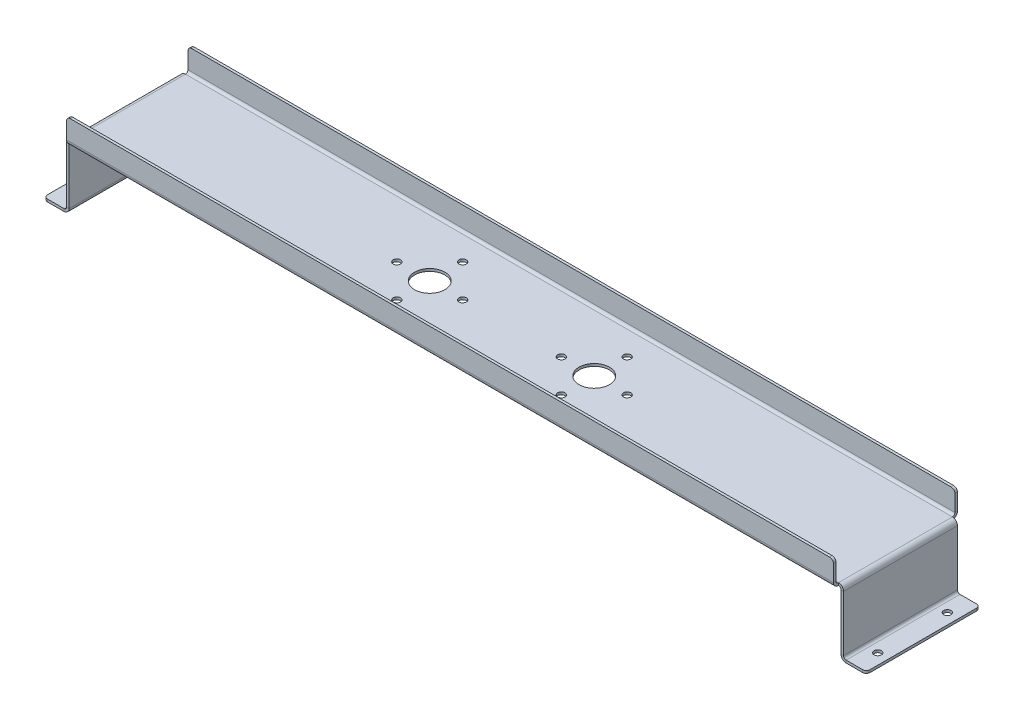
from build123d import *

# Parameters (mm, degrees)
BASE_FLANGE1_DEPTH      = 45
EDGE_FLANGE1_DEPTH      = 606
EDGE_FLANGE1_BEND_DEPTH = 606
SKETCH11_R              = 12
CUT_EXTRUDE1_DEPTH      = 10
FILLET1_R               = 3
M5_CLEARANCE_HOLE1_D    = 5.8
M5_CLEARANCE_HOLE2_D    = 5.8


# Sheet-metal steps are written as plain solids
with BuildPart() as part:
    # Sketch1 → Base-Flange1 (new, symmetric)
    with BuildSketch(Plane.XY):
        with BuildLine():
            Line((-325, 0), (-309, 0))
            ThreePointArc((-309, 0), (-306.171572875, 1.171572875), (-305, 4))
            Line((-305, 4), (-305, 48))
            ThreePointArc((-305, 48), (-304.414213562, 49.414213562), (-303, 50))
            Line((-303, 50), (303, 50))
            ThreePointArc((303, 50), (304.414213562, 49.414213562), (305, 48))
            Line((305, 48), (305, 4))
            ThreePointArc((305, 4), (306.171572875, 1.171572875), (309, 0))
            Line((309, 0), (325, 0))
            Line((325, 0), (325, 2))
            Line((325, 2), (309, 2))
            ThreePointArc((309, 2), (307.585786438, 2.585786438), (307, 4))
            Line((307, 4), (307, 48))
            ThreePointArc((307, 48), (305.828427125, 50.828427125), (303, 52))
            Line((303, 52), (-303, 52))
            ThreePointArc((-303, 52), (-305.828427125, 50.828427125), (-307, 48))
            Line((-307, 48), (-307, 4))
            ThreePointArc((-307, 4), (-307.585786438, 2.585786438), (-309, 2))
            Line((-309, 2), (-325, 2))
            Line((-325, 2), (-325, 0))
        make_face()
    extrude(amount=BASE_FLANGE1_DEPTH, both=True)

    # Edge-Flange1 section (across the edge) → Edge-Flange1 (add)
    with BuildSketch(Plane(origin=(303, 52, -47), x_dir=(0, 0, 1), z_dir=(-1, 0, 0))):
        with BuildLine():
            Line((-2, 2), (-2, 18))
            Line((-2, 18), (0, 18))
            Line((0, 18), (0, 2))
            ThreePointArc((0, 2), (0.585786438, 0.585786438), (2, 0))
            Line((2, 0), (2, -2))
            ThreePointArc((2, -2), (-0.828427125, -0.828427125), (-2, 2))
        make_face()
    extrude(amount=EDGE_FLANGE1_DEPTH)

    # Edge-Flange1 section 2 (across the edge) → Edge-Flange1 bend (add)
    with BuildSketch(Plane(origin=(-303, 52, 47), x_dir=(0, 0, -1), z_dir=(1, 0, 0))):
        with BuildLine():
            Line((-2, 2), (-2, 18))
            Line((-2, 18), (0, 18))
            Line((0, 18), (0, 2))
            ThreePointArc((0, 2), (0.585786438, 0.585786438), (2, 0))
            Line((2, 0), (2, -2))
            ThreePointArc((2, -2), (-0.828427125, -0.828427125), (-2, 2))
        make_face()
    extrude(amount=EDGE_FLANGE1_BEND_DEPTH)

    # Sketch11 → Cut-Extrude1 (cut)
    with BuildSketch(Plane(origin=(0, 52, 0), x_dir=(1, 0, 0), z_dir=(0, 1, 0))):
        with Locations(Location((-65, 0, 0), (0, 0, 270))):
            Circle(SKETCH11_R)
        with Locations(Location((65, 0, 0), (0, 0, 270))):
            Circle(SKETCH11_R)
    extrude(amount=-CUT_EXTRUDE1_DEPTH, mode=Mode.SUBTRACT)

    # Fillet1
    fillet1_edges = [part.edges().sort_by_distance(p)[0] for p in [
        (-325, 1, -45),
        (325, 1, -45),
        (-325, 1, 45),
        (303, 70, -48),
        (-303, 70, -48),
        (325, 1, 45),
        (-303, 70, 48),
        (303, 70, 48),
    ]]
    fillet(fillet1_edges, radius=FILLET1_R)

    # M5 Clearance Hole1 (through all)
    with Locations(Plane(origin=(0, 2, 0), x_dir=(1, 0, 0), z_dir=(0, 1, 0))):
        with Locations((316.5, 27.5), (316.5, -27.5)):
            m5_clearance_hole1 = Hole(M5_CLEARANCE_HOLE1_D / 2)

    # Mirror1: M5 Clearance Hole1 across plane
    add(m5_clearance_hole1.mirror(Plane(origin=(0, 0, 0), x_dir=(0, 0, 1), z_dir=(1, 0, 0))), mode=Mode.SUBTRACT)

    # M5 Clearance Hole2 (through all)
    with Locations(Plane(origin=(0, 52, 0), x_dir=(1, 0, 0), z_dir=(0, 1, 0))):
        with Locations((-91, 0), (-65, 26), (-39, 0), (-65, -26)):
            m5_clearance_hole2 = Hole(M5_CLEARANCE_HOLE2_D / 2)

    # Mirror2: M5 Clearance Hole2 across plane
    add(m5_clearance_hole2.mirror(Plane(origin=(0, 0, 0), x_dir=(0, 0, 1), z_dir=(1, 0, 0))), mode=Mode.SUBTRACT)


solid = part.part
